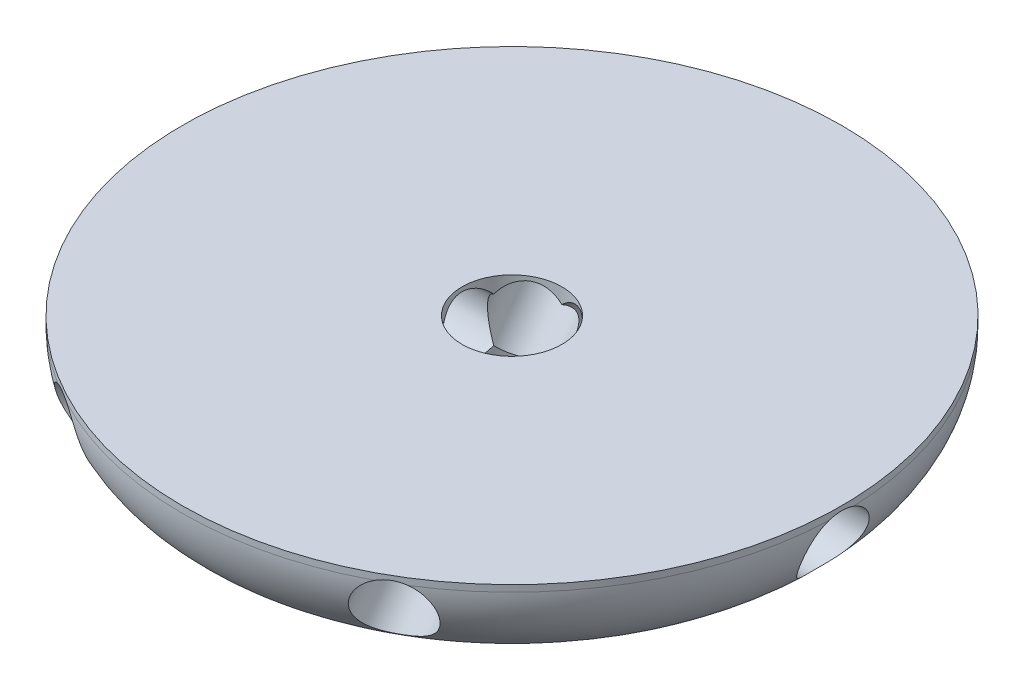
from build123d import *

# Parameters (mm, degrees)
EXTRUDE_1_DEPTH          = 7
EXTRUDE_1_DEPTH_BACK     = 7
SKETCH_1_R               = 50
SKETCH_3_R               = 5.075
CUT_EXTRUDE_1_DEPTH      = 72.056315694
PATTERN_CIRCULAR_1_COUNT = 6
SKETCH_4_R               = 7.575
CUT_EXTRUDE_2_DEPTH      = 73.083285322


with BuildPart() as part:
    # 草图1 → 凸台-拉伸1 (new, two sides: drawn at the far end of the back side and taken through both)
    with BuildSketch(Plane(origin=(0, 0, 0), x_dir=(1, 0, 0), z_dir=(0, 1, 0)).offset(-EXTRUDE_1_DEPTH_BACK)):
        with Locations(Location((0, 0, 0), (0, 0, 270))):
            Circle(SKETCH_1_R)
    extrude(amount=EXTRUDE_1_DEPTH + EXTRUDE_1_DEPTH_BACK)

    # 草图3 → 切除-拉伸1 (cut, through all)
    with BuildSketch(Plane(origin=(0, 0, 0), x_dir=(0, 0, -1), z_dir=(1, 0, 0))):
        with Locations((0, 1.277305247)):
            Circle(SKETCH_3_R)
    cut_extrude_1 = extrude(amount=-CUT_EXTRUDE_1_DEPTH, mode=Mode.SUBTRACT)

    # 阵列(圆周)1: 切除-拉伸1 ×6 about axis
    pattern_circular_1_axis = Axis((0, 7, 0), (0, 1, 0))
    for i in range(1, PATTERN_CIRCULAR_1_COUNT):
        add(cut_extrude_1.rotate(pattern_circular_1_axis, i * 360 / PATTERN_CIRCULAR_1_COUNT), mode=Mode.SUBTRACT)

    # 圆角1: read off the stored shape, not the designer's step
    # 圆角1 outline → 圆角1 (revolve, cut)
    with BuildSketch(Plane.XY):
        with BuildLine():
            ThreePointArc((50, 6.000004089), (46.192389601, -3.19238671), (37, -7))
            Line((37, -7), (50, -7))
            Line((50, -7), (50, 6.000004089))
        make_face()
    revolve(axis=Axis((0, 0, 0), (0, 1, 0)), mode=Mode.SUBTRACT)

    # 草图4 → 切除-拉伸2 (cut, through all)
    with BuildSketch(Plane(origin=(0, 7, 0), x_dir=(1, 0, 0), z_dir=(0, 1, 0))):
        with Locations(Location((0, 0, 0), (0, 0, 270))):
            Circle(SKETCH_4_R)
    extrude(amount=-CUT_EXTRUDE_2_DEPTH, mode=Mode.SUBTRACT)


solid = part.part
